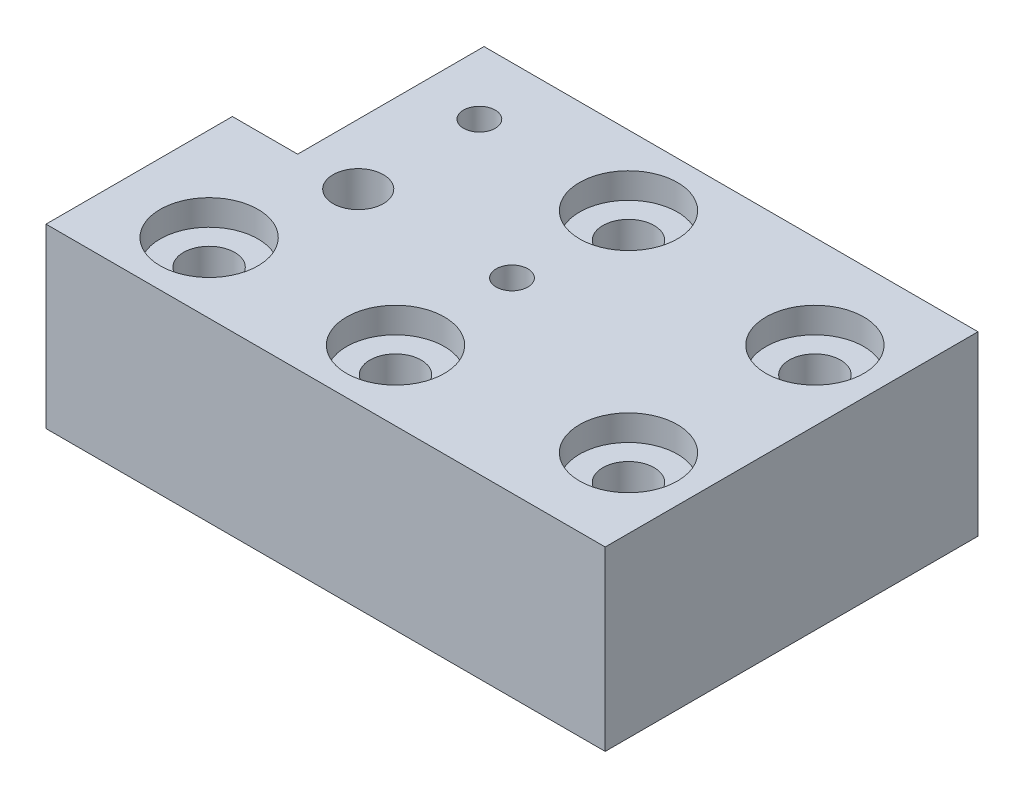
from build123d import *

# Parameters (mm, degrees)
BOSS_EXTRUDE1_DEPTH             = 10
BOSS_EXTRUDE2_DEPTH             = 9
CBORE_FOR_M5_SBHCS1_D           = 5.5
CBORE_FOR_M5_SBHCS1_CBORE_D     = 10.5
CBORE_FOR_M5_SBHCS1_CBORE_DEPTH = 2.75
CBORE_FOR_M5_SBHCS2_D           = 5.5
CBORE_FOR_M5_SBHCS2_CBORE_D     = 10.5
CBORE_FOR_M5_SBHCS2_CBORE_DEPTH = 2.75
CBORE_FOR_M3_SBHCS1_D           = 3.4
CBORE_FOR_M3_SBHCS1_CBORE_D     = 6.7
CBORE_FOR_M3_SBHCS1_CBORE_DEPTH = 16
CBORE_FOR_M3_SBHCS2_D           = 3.4
CBORE_FOR_M3_SBHCS2_CBORE_D     = 6.7
CBORE_FOR_M3_SBHCS2_CBORE_DEPTH = 6
F_5_4_5_4_DIAMETER_HOLE1_D      = 5.4
FILLET3_R                       = 9


with BuildPart() as part:
    # Sketch1 → Boss-Extrude1 (new body)
    with BuildSketch(Plane(origin=(0, 0, 0), x_dir=(1, 0, 0), z_dir=(0, 1, 0))):
        Polygon((0, 0), (60, 0), (60, 40), (20, 40), (20, 20), (0, 20), align=None)
    extrude(amount=BOSS_EXTRUDE1_DEPTH)

    # Sketch2 → Boss-Extrude2 (add)
    with BuildSketch(Plane(origin=(0, 10, 0), x_dir=(1, 0, 0), z_dir=(0, 1, 0))):
        Polygon((20, 40), (7, 40), (7, 20), (0, 20), (0, 0), (60, 0), (60, 40), align=None)
    extrude(amount=BOSS_EXTRUDE2_DEPTH)

    # CBORE for M5 SBHCS1 (through all)
    with Locations(Plane(origin=(0, 19, 0), x_dir=(1, 0, 0), z_dir=(0, 1, 0))):
        with Locations((10, 7.5), (30, 7.5), (30, 32.5)):
            CounterBoreHole(CBORE_FOR_M5_SBHCS1_D / 2, CBORE_FOR_M5_SBHCS1_CBORE_D / 2, CBORE_FOR_M5_SBHCS1_CBORE_DEPTH)

    # CBORE for M5 SBHCS2 (through all)
    with Locations(Plane(origin=(0, 19, 0), x_dir=(1, 0, 0), z_dir=(0, 1, 0))):
        with Locations((52.5, 30), (52.5, 10)):
            CounterBoreHole(CBORE_FOR_M5_SBHCS2_D / 2, CBORE_FOR_M5_SBHCS2_CBORE_D / 2, CBORE_FOR_M5_SBHCS2_CBORE_DEPTH)

    # CBORE for M3 SBHCS1 (through all)
    with Locations(Plane(origin=(0, 0, 0), x_dir=(-1, 0, 0), z_dir=(0, -1, 0))):
        with Locations((-30, 20)):
            CounterBoreHole(CBORE_FOR_M3_SBHCS1_D / 2, CBORE_FOR_M3_SBHCS1_CBORE_D / 2, CBORE_FOR_M3_SBHCS1_CBORE_DEPTH)

    # CBORE for M3 SBHCS2 (through all)
    with Locations(Plane(origin=(0, 10, 0), x_dir=(-1, 0, 0), z_dir=(0, -1, 0))):
        with Locations((-13.5, 33)):
            CounterBoreHole(CBORE_FOR_M3_SBHCS2_D / 2, CBORE_FOR_M3_SBHCS2_CBORE_D / 2, CBORE_FOR_M3_SBHCS2_CBORE_DEPTH)

    # Ø5.4 (5.4) Diameter Hole1 (through all)
    with Locations(Plane(origin=(0, 0, 0), x_dir=(-1, 0, 0), z_dir=(0, -1, 0))):
        with Locations((-13.5, 20)):
            Hole(F_5_4_5_4_DIAMETER_HOLE1_D / 2)

    # Fillet3
    # the kernel refuses this fillet: 9 mm, written as the material it adds along each edge
    with BuildSketch(Plane(origin=(20, 10, -40), x_dir=(0, -1, 0), z_dir=(0, 0, 1))) as fillet3_piece_1_section:
        with BuildLine():
            CenterArc((FILLET3_R, -FILLET3_R), FILLET3_R, 90, 90)
            Line((0, -FILLET3_R), (0, 0))
            Line((0, 0), (FILLET3_R, 0))
        make_face()
    fillet3_piece_1 = extrude(amount=20, mode=Mode.PRIVATE)
    fillet3_piece_1 = fillet3_piece_1 - Plane(origin=(13.5, 7.877517224, -20), x_dir=(1, 0, 0), z_dir=(0, 1, 0)) * Cylinder(2.7, 76, mode=Mode.PRIVATE)
    fillet3_piece_1 = fillet3_piece_1 - Plane(origin=(13.5, 7.877517224, -33), x_dir=(-1, 0, 0), z_dir=(0, -1, 0)) * Cylinder(3.35, 76, mode=Mode.PRIVATE)
    add(fillet3_piece_1)
    with BuildSketch(Plane(origin=(33.3, 10, -20), x_dir=(0, -1, 0), z_dir=(-1, 0, 0))) as fillet3_piece_2_section:
        with BuildLine():
            CenterArc((FILLET3_R, -FILLET3_R), FILLET3_R, 90, 90)
            Line((0, -FILLET3_R), (0, 0))
            Line((0, 0), (FILLET3_R, 0))
        make_face()
    fillet3_piece_2 = extrude(amount=26.3, mode=Mode.PRIVATE)
    fillet3_piece_2 = fillet3_piece_2 - Plane(origin=(13.5, 3.343699997, -20), x_dir=(1, 0, 0), z_dir=(0, 1, 0)) * Cylinder(2.7, 89, mode=Mode.PRIVATE)
    fillet3_piece_2 = split(fillet3_piece_2, bisect_by=Plane(origin=(20, 3.343699997, -20.253192533), z_dir=(-1, 0, 0)), keep=Keep.TOP, mode=Mode.PRIVATE)
    add(fillet3_piece_2)


solid = part.part
